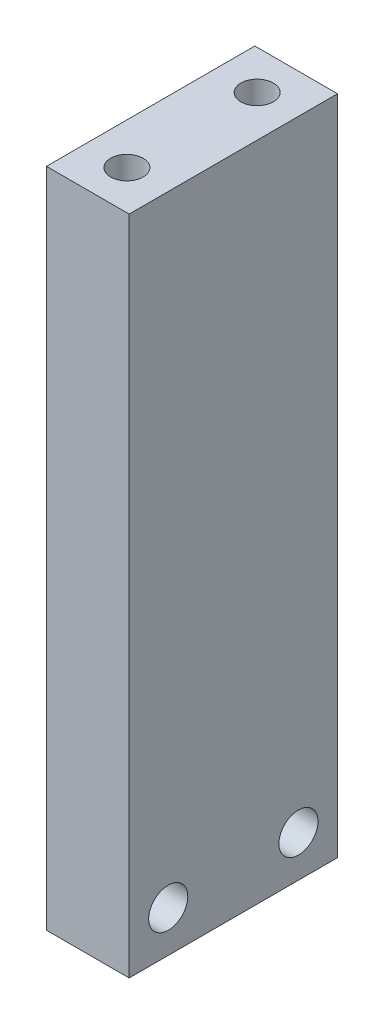
from build123d import *

# Parameters (mm, degrees)
SKETCH1_W           = 6.35
SKETCH1_H           = 50.8
BOSS_EXTRUDE1_DEPTH = 16
SKETCH4_R           = 1.5
CUT_EXTRUDE3_DEPTH  = 6.35
SKETCH5_R           = 1.25
CUT_EXTRUDE4_DEPTH  = 4


with BuildPart() as part:
    # Sketch1 → Boss-Extrude1 (new body)
    with BuildSketch(Plane.XY):
        with Locations((3.175, 25.4)):
            Rectangle(SKETCH1_W, SKETCH1_H)
    extrude(amount=BOSS_EXTRUDE1_DEPTH)

    # Sketch4 → Cut-Extrude3 (cut)
    with BuildSketch(Plane(origin=(6.35, 0, 0), x_dir=(0, 0, -1), z_dir=(1, 0, 0))):
        with Locations((-3, 3.175)):
            Circle(SKETCH4_R)
        with Locations((-13, 3.175)):
            Circle(SKETCH4_R)
    extrude(amount=-CUT_EXTRUDE3_DEPTH, mode=Mode.SUBTRACT)

    # Sketch5 → Cut-Extrude4 (cut)
    with BuildSketch(Plane(origin=(0, 50.8, 0), x_dir=(1, 0, 0), z_dir=(0, 1, 0))):
        with Locations((3.175, -3)):
            Circle(SKETCH5_R)
        with Locations((3.175, -13)):
            Circle(SKETCH5_R)
    extrude(amount=-CUT_EXTRUDE4_DEPTH, mode=Mode.SUBTRACT)


solid = part.part
